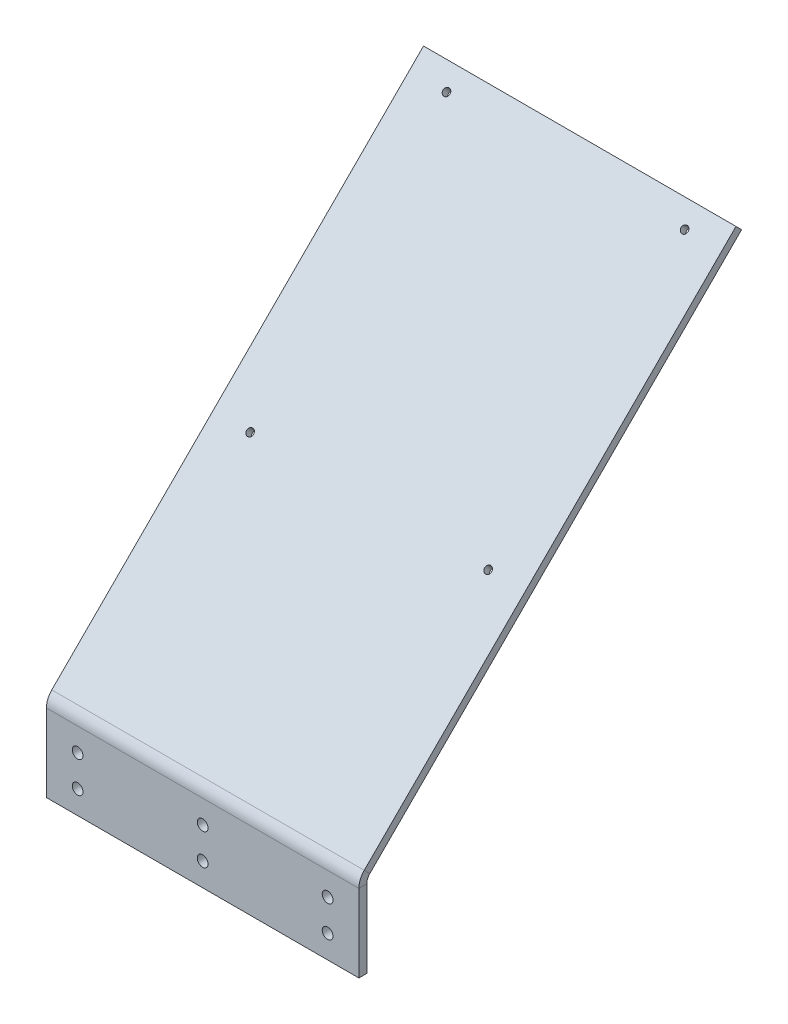
from build123d import *

# Parameters (mm, degrees)
SKETCH1_W                  = 100
SKETCH1_H                  = 196.50497
BASE_FLANGE1_DEPTH         = 2.54
CUT_EXTRUDE1_DEPTH         = 221.500917991
CUT_EXTRUDE1_DEPTH_BACK    = 221.500917991
SKETCH1_4_R                = 1.13
SKETCHED_START             = -70.001308696
SKETCHED_BEND3_OUTLINE_R   = 1.13
SKETCHED_BEND3_DEPTH       = 55.325410031
SKETCHED_BEND3_2_DEPTH     = 100
SKETCHED_BEND3_3_DEPTH     = 100
SKETCHED_START_2           = -123
SKETCHED_BEND3_4_OUTLINE_R = 1.13
SKETCHED_BEND3_4_DEPTH     = 4
CUT_EXTRUDE3_DEPTH         = 253.225301809
CUT_EXTRUDE3_DEPTH_BACK    = 253.225301809
SKETCH19_R                 = 1.725
F_4_40_TAPPED_HOLE1_D      = 2.2606


with BuildPart() as part:
    # Base-Flange1: sheet metal written as solids
    # Sketch1 → Base-Flange1 (new body)
    with BuildSketch(Plane.XY):
        with Locations((50, -98.252485)):
            Rectangle(SKETCH1_W, SKETCH1_H)
    extrude(amount=-BASE_FLANGE1_DEPTH)

    # Sketch1<4> → Cut-Extrude1 (cut, two sides: drawn at the far end of the back side and taken through both)
    with BuildSketch(Plane.XY.offset(-CUT_EXTRUDE1_DEPTH_BACK)):
        with Locations((11.9, -6.4268)):
            Circle(SKETCH1_4_R)
        with Locations((88.1, -6.4268)):
            Circle(SKETCH1_4_R)
        with Locations((88.1, -95.3268)):
            Circle(SKETCH1_4_R)
        with Locations((11.9, -95.3268)):
            Circle(SKETCH1_4_R)
    extrude(amount=CUT_EXTRUDE1_DEPTH + CUT_EXTRUDE1_DEPTH_BACK, mode=Mode.SUBTRACT)

    # Sketched Bend3: read off the stored shape, not the designer's step
    # Sketched Bend3 outline → Sketched Bend3 (cut)
    with BuildSketch(Plane(origin=(0, 0, 0), x_dir=(1, 0, 0), z_dir=(0, 0.707106781186549, 0.707106781186546)).offset(SKETCHED_START)):
        with Locations((88.1, -44.309515504)):
            Circle(SKETCHED_BEND3_OUTLINE_R)
        with Locations((11.9, -44.309515504)):
            Circle(SKETCHED_BEND3_OUTLINE_R)
    extrude(amount=SKETCHED_BEND3_DEPTH, mode=Mode.SUBTRACT)

    # Sketched Bend3 2 outline → Sketched Bend3 2 (cut)
    with BuildSketch(Plane.YZ):
        with BuildLine():
            ThreePointArc((-171.665649191, 0), (-169.42029242, -0.446629231), (-167.516770864, -1.718521672))
            Line((-167.516770864, -1.718521672), (-166.695292536, -2.54))
            Line((-166.695292536, -2.54), (0, -2.54))
            Line((0, -2.54), (0, 0))
            Line((0, 0), (-171.665649191, 0))
        make_face()
    extrude(amount=SKETCHED_BEND3_2_DEPTH, mode=Mode.SUBTRACT)

    # Sketched Bend3 3 outline → Sketched Bend3 3 (add)
    with BuildSketch(Plane.YZ):
        with BuildLine():
            Line((-48.542978443, -120.692314093), (-166.695292536, -2.54))
            Line((-166.695292536, -2.54), (-171.665649191, -2.54))
            ThreePointArc((-171.665649191, -2.54), (-170.392308339, -2.793283244), (-169.312822088, -3.514572896))
            Line((-169.312822088, -3.514572896), (-50.339029667, -122.488365317))
            Line((-50.339029667, -122.488365317), (-48.542978443, -120.692314093))
        make_face()
    extrude(amount=SKETCHED_BEND3_3_DEPTH)

    # Sketched Bend3 4 outline → Sketched Bend3 4 (cut)
    with BuildSketch(Plane(origin=(0, 0, 0), x_dir=(1, 0, 0), z_dir=(0, 0.707106781186549, 0.707106781186546)).offset(SKETCHED_START_2)):
        with Locations((11.9, 44.590484496)):
            Circle(SKETCHED_BEND3_4_OUTLINE_R)
        with Locations((88.1, 44.590484496)):
            Circle(SKETCHED_BEND3_4_OUTLINE_R)
        with Locations((88.1, -44.309515504)):
            Circle(SKETCHED_BEND3_4_OUTLINE_R)
        with Locations((11.9, -44.309515504)):
            Circle(SKETCHED_BEND3_4_OUTLINE_R)
    extrude(amount=SKETCHED_BEND3_4_DEPTH, mode=Mode.SUBTRACT)

    # Sketch19 → Cut-Extrude3 (cut, two sides: drawn at the far end of the back side and taken through both)
    with BuildSketch(Plane.XY.offset(-CUT_EXTRUDE3_DEPTH_BACK)):
        with Locations((10, -179.08497)):
            Circle(SKETCH19_R)
        with Locations((50, -179.08497)):
            Circle(SKETCH19_R)
        with Locations((90, -179.08497)):
            Circle(SKETCH19_R)
        with Locations((50, -189.08497)):
            Circle(SKETCH19_R)
        with Locations((90, -189.08497)):
            Circle(SKETCH19_R)
        with Locations((10, -189.08497)):
            Circle(SKETCH19_R)
    extrude(amount=CUT_EXTRUDE3_DEPTH + CUT_EXTRUDE3_DEPTH_BACK, mode=Mode.SUBTRACT)

    # #4-40 Tapped Hole1 (through all)
    with Locations(Plane(origin=(88.1, -115.949205151, -53.286087384), x_dir=(0, -0.707106781187, 0.707106781187), z_dir=(0, 0.707106781187, 0.707106781187))):
        with Locations((0, 0), (0, -76.2), (-88.9, -76.2), (-88.9, 0)):
            Hole(F_4_40_TAPPED_HOLE1_D / 2)


solid = part.part
